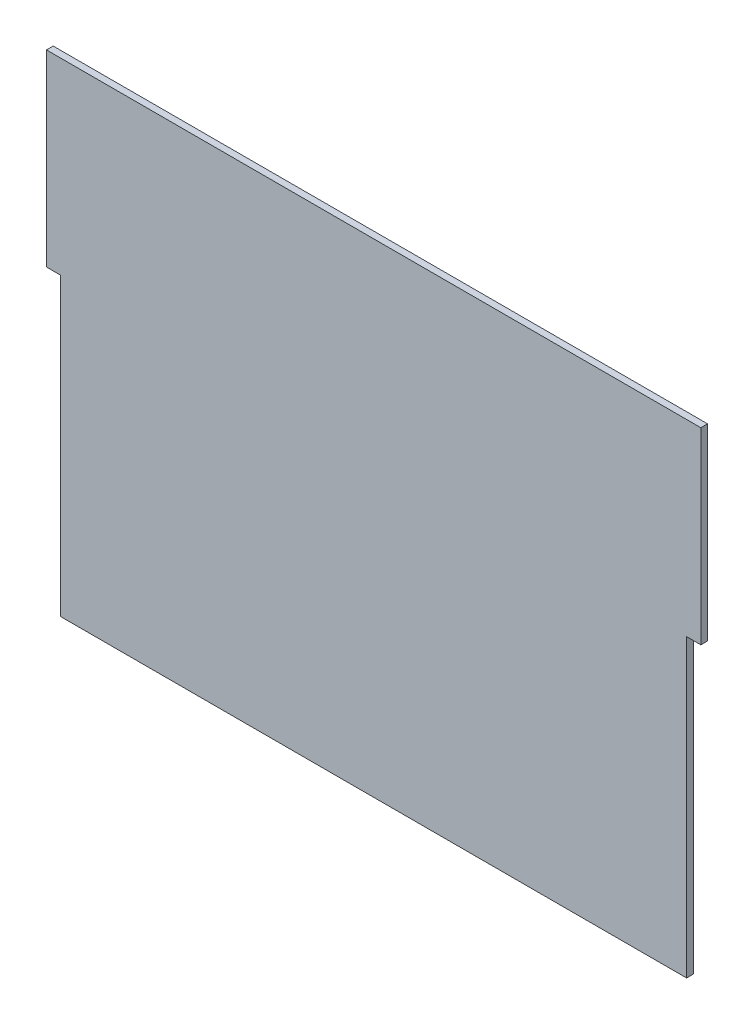
from build123d import *

# Parameters (mm, degrees)
BOSS_EXTRUDE1_DEPTH = 2.9972


with BuildPart() as part:
    # Sketch1 → Boss-Extrude1 (new body)
    with BuildSketch(Plane.XY):
        Polygon((-146.05, 107.95), (-146.05, 24.003), (-139.7, 24.003), (-139.7, -107.95), (139.7, -107.95), (139.7, 24.003), (146.05, 24.003), (146.05, 107.95), align=None)
    extrude(amount=BOSS_EXTRUDE1_DEPTH)


solid = part.part
